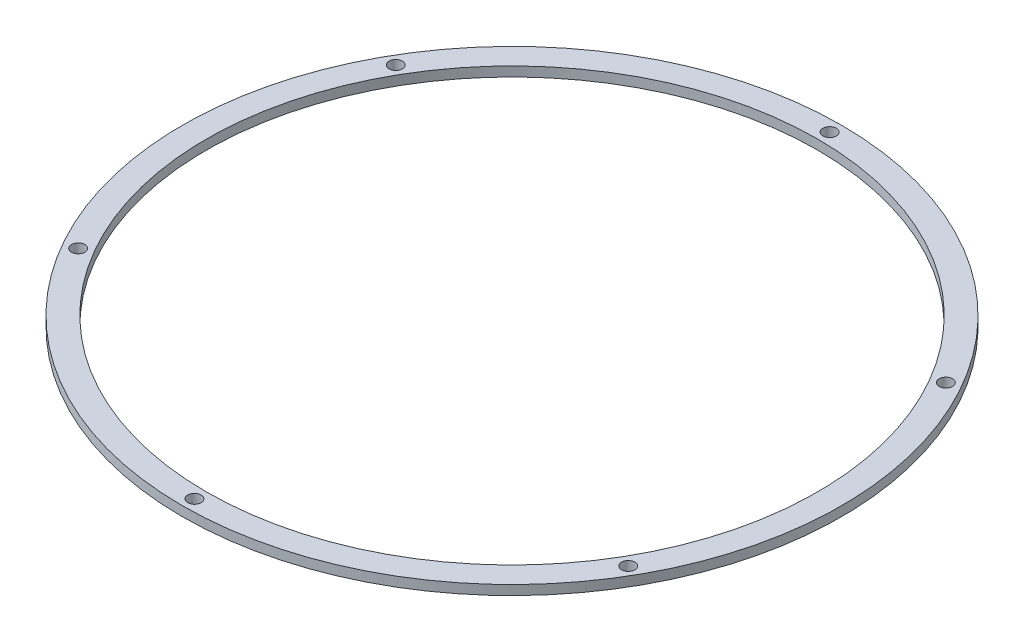
from build123d import *

# Parameters (mm, degrees)
SKETCH1_R           = 174.85
SKETCH1_R_2         = 3.556
SKETCH1_R_3         = 162.15
BOSS_EXTRUDE1_DEPTH = 5.08


with BuildPart() as part:
    # Sketch1 → Boss-Extrude1 (new body)
    with BuildSketch(Plane(origin=(0, 0, 0), x_dir=(1, 0, 0), z_dir=(0, 1, 0))):
        Circle(SKETCH1_R)
        with Locations((0, 168.5)):
            Circle(SKETCH1_R_2, mode=Mode.SUBTRACT)
        with Locations((145.925280538, 84.25)):
            Circle(SKETCH1_R_2, mode=Mode.SUBTRACT)
        with Locations((145.925280538, -84.25)):
            Circle(SKETCH1_R_2, mode=Mode.SUBTRACT)
        with Locations((0, -168.5)):
            Circle(SKETCH1_R_2, mode=Mode.SUBTRACT)
        with Locations((-145.925280538, -84.25)):
            Circle(SKETCH1_R_2, mode=Mode.SUBTRACT)
        with Locations((-145.925280538, 84.25)):
            Circle(SKETCH1_R_2, mode=Mode.SUBTRACT)
        Circle(SKETCH1_R_3, mode=Mode.SUBTRACT)
    extrude(amount=BOSS_EXTRUDE1_DEPTH)


solid = part.part
